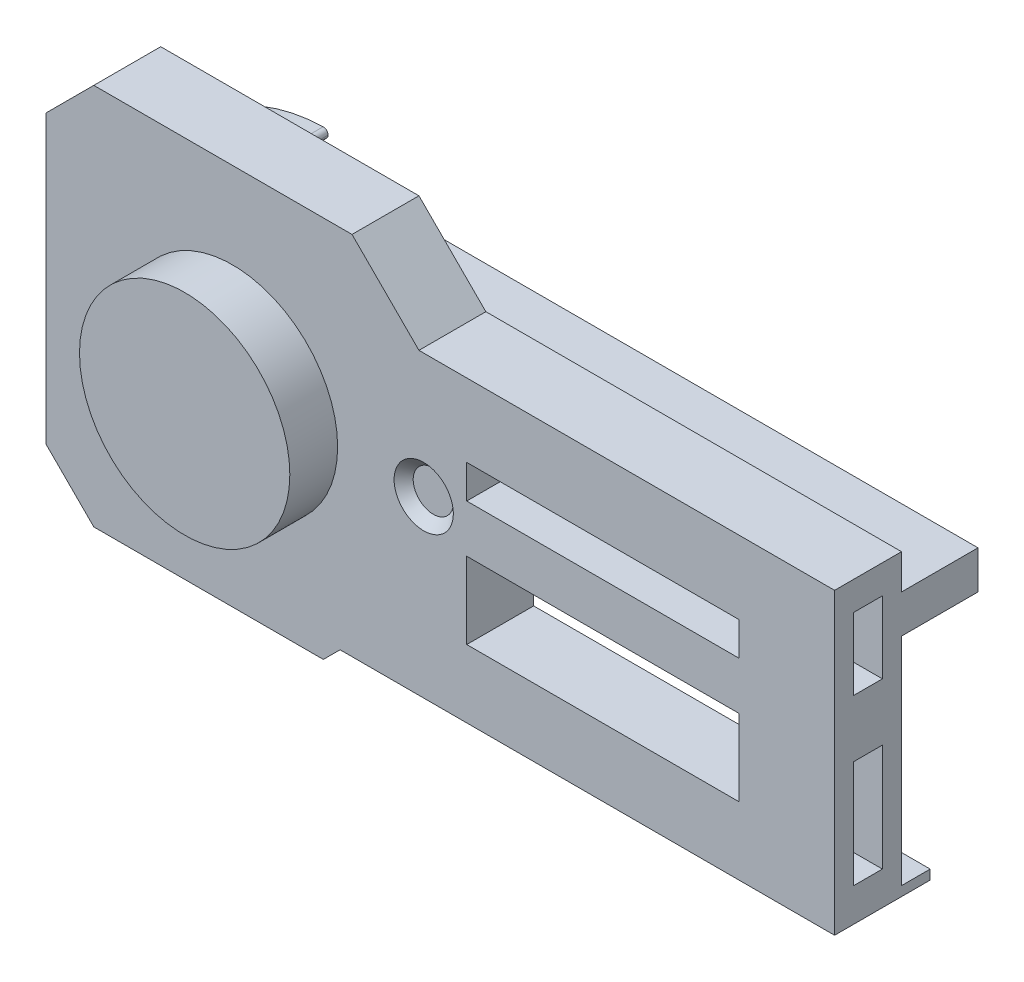
from build123d import *

# Parameters (mm, degrees)
SKETCH1_R               = 5.35
BOSS_EXTRUDE2_DEPTH     = 7
BOSS_EXTRUDE3_START     = 8
SKETCH3_R               = 5.35
BOSS_EXTRUDE3_DEPTH     = 8
BOSS_EXTRUDE4_DEPTH     = 3
CHAMFER1_SIZE           = 10
CHAMFER2_SIZE           = 5
CUT_EXTRUDE1_DEPTH      = 67.560662475
CUT_EXTRUDE1_DEPTH_BACK = 67.560662475
SKETCH5_W               = 28.474956737
SKETCH5_H               = 3.5
SKETCH5_H_2             = 8
CHAMFER3_SIZE           = 7
SKETCH6_R               = 11
BOSS_EXTRUDE5_DEPTH     = 5
SKETCH8_W               = 3
SKETCH8_H               = 7.519820499
SKETCH8_H_2             = 11.230179501
CUT_EXTRUDE2_DEPTH      = 5
CUT_EXTRUDE3_REACH      = 91.372
SKETCH9_W               = 8
SKETCH9_H               = 4
SKETCH10_R              = 3.1
CUT_EXTRUDE4_DEPTH      = 4
SKETCH11_R              = 3.1
CUT_EXTRUDE5_DEPTH      = 1
CHAMFER4_SIZE           = 1
FILLET1_R               = 0.5


# Some blends are built 0.0001 mm under size
with BuildPart() as part:
    # Sketch1 → Boss-Extrude2 (new body)
    with BuildSketch(Plane.XY):
        Polygon((-19.503784034, -20), (19.503784034, -20), (19.503784034, -18.25), (62.978740771, -18.25), (62.978740771, 13), (19.503784034, 13), (19.503784034, 20), (-19.503784034, 20), align=None)
        Circle(SKETCH1_R, mode=Mode.SUBTRACT)
    extrude(amount=-BOSS_EXTRUDE2_DEPTH)

    # Sketch3 → Boss-Extrude3 (add)
    with BuildSketch(Plane.XY.offset(BOSS_EXTRUDE3_START)):
        with BuildLine():
            Line((7.668115805, 5.35), (62.978740771, 5.35))
            Line((62.978740771, 5.35), (62.978740771, 9.35))
            Line((62.978740771, 9.35), (0, 9.35))
            ThreePointArc((0, 9.35), (-9.35, 0), (0, -9.35))
            Line((0, -9.35), (62.978740771, -9.35))
            Line((62.978740771, -9.35), (62.978740771, -5.35))
            Line((62.978740771, -5.35), (7.668115805, -5.35))
            ThreePointArc((7.668115805, -5.35), (9.35, 0), (7.668115805, 5.35))
        make_face()
        Circle(SKETCH3_R, mode=Mode.SUBTRACT)
    extrude(amount=-BOSS_EXTRUDE3_DEPTH)

    # Sketch4 → Boss-Extrude4 (add)
    with BuildSketch(Plane.XY):
        with BuildLine():
            Line((0, -18.25), (62.978740771, -18.25))
            Line((62.978740771, -18.25), (62.978740771, -17.25))
            Line((62.978740771, -17.25), (8.306623863, -17.25))
            Line((8.306623863, -17.25), (0, -17.25))
            ThreePointArc((0, -17.25), (-17.25, 0), (0, 17.25))
            Line((0, 17.25), (0, 18.25))
            ThreePointArc((0, 18.25), (-18.25, 0), (0, -18.25))
        make_face()
    extrude(amount=BOSS_EXTRUDE4_DEPTH)

    # Chamfer1
    # the kernel refuses this chamfer: 10 mm, written as the material it takes off along each edge
    with BuildSketch(Plane(origin=(19.503784034, -20, 25.71682988), x_dir=(-0.9996219169112968, -0.027495876610586317, 0), z_dir=(0, 0, -1))) as chamfer1_piece_1_section:
        Polygon((CHAMFER1_SIZE * 0.999621916911, CHAMFER1_SIZE * 0.0274958766106), (-CHAMFER1_SIZE * 0.0274958766106, CHAMFER1_SIZE * 0.999621916911), (0, 0), align=None)
    chamfer1_piece_1 = extrude(amount=58.433659759, mode=Mode.PRIVATE)
    chamfer1_piece_1 = split(chamfer1_piece_1, bisect_by=Plane(origin=(14.814200223, -18.25, -3.5), z_dir=(0, -1, 0)), keep=Keep.TOP, mode=Mode.PRIVATE)
    add(chamfer1_piece_1, mode=Mode.SUBTRACT)

    # Chamfer2
    chamfer2_edges = [part.edges().sort_by_distance(p)[0] for p in [
        (-19.503784034, -20, -3.5),
        (-19.503784034, 20, -3.5),
    ]]
    chamfer(chamfer2_edges, length=CHAMFER2_SIZE)

    # Sketch5 → Cut-Extrude1 (cut, two sides: drawn at the far end of the back side and taken through both)
    with BuildSketch(Plane.XY.offset(-CUT_EXTRUDE1_DEPTH_BACK)):
        with Locations((38.741262403, 3.6)):
            Rectangle(SKETCH5_W, SKETCH5_H)
        with Locations((38.741262403, -7.15)):
            Rectangle(SKETCH5_W, SKETCH5_H_2)
    extrude(amount=CUT_EXTRUDE1_DEPTH + CUT_EXTRUDE1_DEPTH_BACK, mode=Mode.SUBTRACT)

    # Chamfer3
    chamfer3_edges = [part.edges().sort_by_distance(p)[0] for p in [
        (19.503784034, 20, -3.5),
    ]]
    chamfer(chamfer3_edges, length=CHAMFER3_SIZE - 0.0001)  # a hair under: the kernel refuses the full size


with BuildPart() as body_2:
    # Mirror9: mirrored copy
    add(part.part.mirror(Plane.XY.offset(-10)))

    # Sketch6 → Boss-Extrude5 (add)
    with BuildSketch(Plane.XY.offset(-13)):
        Circle(SKETCH6_R)
    extrude(amount=BOSS_EXTRUDE5_DEPTH)

    # Sketch8 → Cut-Extrude2 (cut)
    with BuildSketch(Plane(origin=(62.978740771, 0, 0), x_dir=(0, 0, -1), z_dir=(1, 0, 0))):
        with Locations((16.5, 6.240089751)):
            Rectangle(SKETCH8_W, SKETCH8_H)
        with Locations((16.5, -9.13491025)):
            Rectangle(SKETCH8_W, SKETCH8_H_2)
    extrude(amount=-CUT_EXTRUDE2_DEPTH, mode=Mode.SUBTRACT)

    # Sketch9 → Cut-Extrude3 (cut, up to next)
    with BuildSketch(Plane(origin=(62.978740771, 0, 0), x_dir=(0, 0, -1), z_dir=(1, 0, 0)), mode=Mode.PRIVATE) as cut_extrude3_sk1:
        with Locations((24, -7.35)):
            Rectangle(SKETCH9_W, SKETCH9_H)
    cut_extrude3_tool1 = extrude(cut_extrude3_sk1.sketch, amount=-CUT_EXTRUDE3_REACH, mode=Mode.PRIVATE) & body_2.part
    add(cut_extrude3_tool1.solids().sort_by_distance((62.978741, -7.35, -24))[0], mode=Mode.SUBTRACT)

    # Sketch10 → Cut-Extrude4 (cut)
    with BuildSketch(Plane(origin=(0, 0, -20), x_dir=(-1, 0, 0), z_dir=(0, 0, -1))):
        with Locations((-20.003784034, 0)):
            Circle(SKETCH10_R)
    extrude(amount=-CUT_EXTRUDE4_DEPTH, mode=Mode.SUBTRACT)

    # Sketch11 → Cut-Extrude5 (cut)
    with BuildSketch(Plane.XY.offset(-13)):
        with Locations(Location((20.003784034, 0, 0), (0, 0, 180))):
            Circle(SKETCH11_R)
    extrude(amount=-CUT_EXTRUDE5_DEPTH, mode=Mode.SUBTRACT)

    # Chamfer4
    chamfer4_edges = [body_2.edges().sort_by_distance(p)[0] for p in [
        (23.103784034, 0, -14),
    ]]
    chamfer(chamfer4_edges, length=CHAMFER4_SIZE - 0.0001)  # a hair under: the kernel refuses the full size

    # Fillet1
    fillet1_edges = [body_2.edges().sort_by_distance(p)[0] for p in [
        (0, 18.25, -21.5),
        (0, 17.25, -21.5),
    ]]
    fillet(fillet1_edges, radius=FILLET1_R - 0.0001)  # a hair under: the kernel refuses the full size


solid = body_2.part
